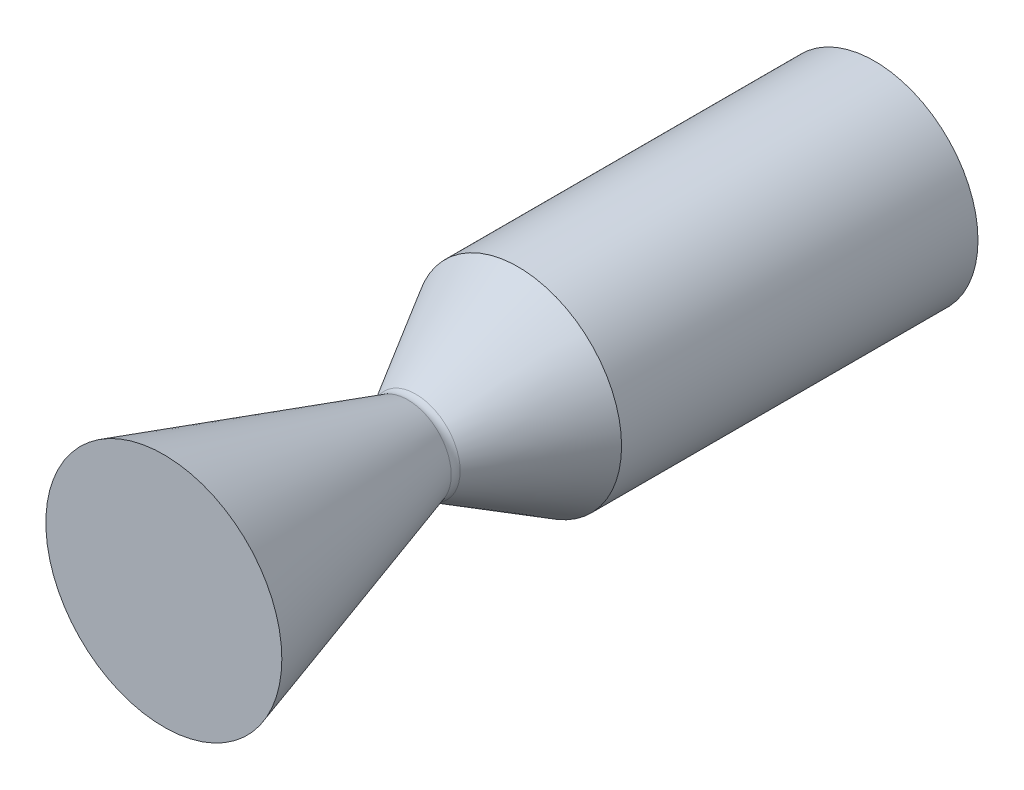
from build123d import *


# Read off the part's stored shape, not the designer's step: Revolve4
with BuildPart() as part:
    # Sketch2 → Revolve1 (revolve)
    with BuildSketch(Plane(origin=(0, 0, 0), x_dir=(1, 0, 0), z_dir=(0, 1, 0)), mode=Mode.PRIVATE) as revolve1_sk:
        with BuildLine():
            Line((0, 88.9), (-23.467681094, 88.9))
            Line((-23.467681094, 88.9), (-23.467681094, 0))
            Line((-23.467681094, 0), (-8.405449734, -26.088549992))
            ThreePointArc((-8.405449734, -26.088549992), (-8.081511216, -27.07075529), (-8.175988072, -28.10067642))
            Line((-8.175988072, -28.10067642), (-27.000254561, -89.717228424))
            Line((-27.000254561, -89.717228424), (0, -89.717228424))
            Line((0, -89.717228424), (0, 88.9))
        make_face()
    revolve(revolve1_sk.sketch.rotate(Axis((0, 0, 0), (0, 0, -1)), 180), axis=Axis((0, 0, 0), (0, 0, -1)))

    # Revolve4 outline → Revolve4 (revolve)
    with BuildSketch(Plane.XZ):
        with BuildLine():
            Line((23.467681094, -88.9), (26.007681094, -88.9))
            Line((26.007681094, -88.9), (26.007681094, 0.680590949))
            Line((26.007681094, 0.680590949), (11.157211277, 26.402359187))
            ThreePointArc((11.157211277, 26.402359187), (10.83327276, 27.384564486), (10.927749616, 28.414485616))
            Line((10.927749616, 28.414485616), (29.656145308, 89.717228424))
            Line((29.656145308, 89.717228424), (27.000254561, 89.717228424))
            Line((27.000254561, 89.717228424), (8.175988072, 28.10067642))
            ThreePointArc((8.175988072, 28.10067642), (8.081511216, 27.07075529), (8.405449734, 26.088549992))
            Line((8.405449734, 26.088549992), (23.467681094, 0))
            Line((23.467681094, 0), (23.467681094, -88.9))
        make_face()
    revolve(axis=Axis((0, 0, 0), (0, 0, 1)))


solid = part.part
